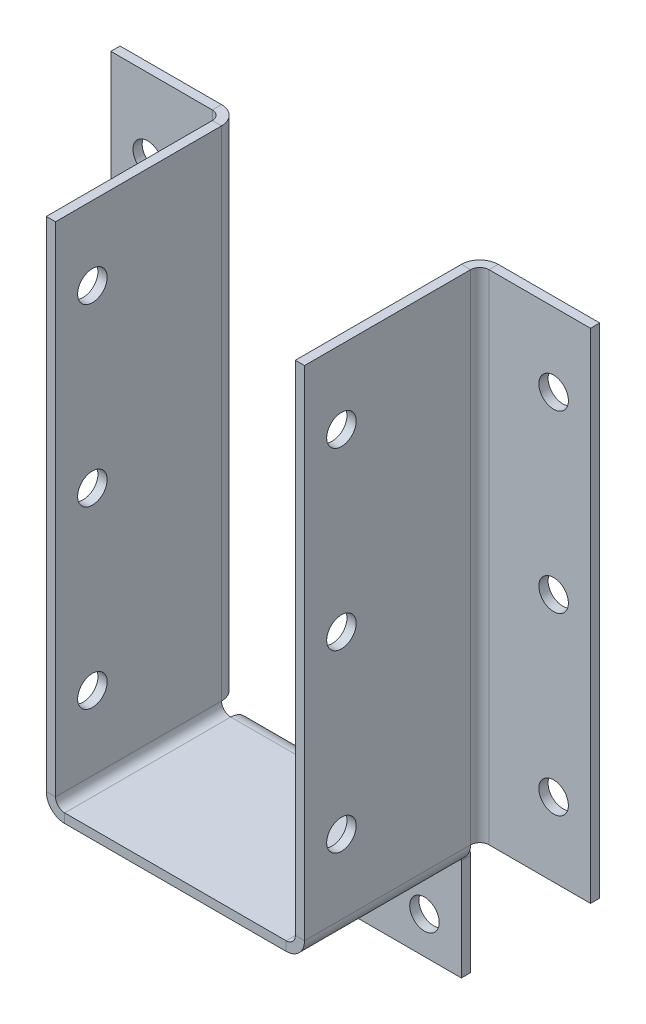
from build123d import *

# Parameters (mm, degrees)
BASE_FLANGE_DEPTH         = 31.75
MITER_FLANGE2_DEPTH       = 88.9
MITER_FLANGE2_2_DEPTH     = 3.175
MITER_START               = 3.175
MITER_FLANGE2_3_DEPTH     = 85.725
MITER_START_2             = -19.05
MITER_FLANGE2_4_OUTLINE_W = 19.05
MITER_FLANGE2_4_OUTLINE_H = 1.5875
MITER_FLANGE2_4_DEPTH     = 17.4625
MITER_FLANGE2_5_DEPTH     = 19.05
MITER_FLANGE2_6_DEPTH     = 19.05
CUT_EXTRUDE1_REACH        = 105.029
SKETCH4_R                 = 2.54
CUT_EXTRUDE2_REACH        = 105.029
SKETCH5_R                 = 2.54
CUT_EXTRUDE4_REACH        = 107.049
SKETCH7_R                 = 2.54


with BuildPart() as part:
    # Base-Flange: sheet metal written as solids
    # Sketch1 → Base-Flange (new body)
    with BuildSketch(Plane.XY):
        with BuildLine():
            Line((0, 0), (19.05, 0))
            ThreePointArc((19.05, 0), (21.29506403, 0.92993597), (22.225, 3.175))
            Line((22.225, 3.175), (22.225, 88.9))
            Line((22.225, 88.9), (20.6375, 88.9))
            Line((20.6375, 88.9), (20.6375, 3.175))
            ThreePointArc((20.6375, 3.175), (20.172532015, 2.052467985), (19.05, 1.5875))
            Line((19.05, 1.5875), (0, 1.5875))
            Line((0, 1.5875), (0, 0))
        make_face()
    extrude(amount=BASE_FLANGE_DEPTH)

    # Miter Flange2: read off the stored shape, not the designer's step
    # Miter Flange2 outline → Miter Flange2 (cut)
    with BuildSketch(Plane(origin=(0, 0, 0), x_dir=(1, 0, 0), z_dir=(0, 1, 0))):
        with BuildLine():
            Line((22.225, 0), (19.05, 0))
            Line((19.05, 0), (19.05, -3.175))
            Line((19.05, -3.175), (20.6375, -3.175))
            ThreePointArc((20.6375, -3.175), (21.062869343, -1.5875), (22.225, -0.425369343))
            Line((22.225, -0.425369343), (22.225, 0))
        make_face()
    extrude(amount=MITER_FLANGE2_DEPTH, mode=Mode.SUBTRACT)

    # Miter Flange2 2 outline → Miter Flange2 2 (cut)
    with BuildSketch(Plane(origin=(0, 0, 0), x_dir=(1, 0, 0), z_dir=(0, 1, 0))):
        with BuildLine():
            Line((20.6375, -3.175), (22.225, -3.175))
            Line((22.225, -3.175), (22.225, -0.425369343))
            ThreePointArc((22.225, -0.425369343), (21.062869343, -1.5875), (20.6375, -3.175))
        make_face()
    extrude(amount=MITER_FLANGE2_2_DEPTH, mode=Mode.SUBTRACT)

    # Miter Flange2 3 outline → Miter Flange2 3 (add)
    with BuildSketch(Plane(origin=(0, 0, 0), x_dir=(1, 0, 0), z_dir=(0, 1, 0)).offset(MITER_START)):
        with BuildLine():
            Line((22.225, -0.425369343), (22.225, -3.175))
            ThreePointArc((22.225, -3.175), (22.689967985, -2.052467985), (23.8125, -1.5875))
            Line((23.8125, -1.5875), (41.275, -1.5875))
            Line((41.275, -1.5875), (41.275, 0))
            Line((41.275, 0), (23.8125, 0))
            ThreePointArc((23.8125, 0), (22.990749532, -0.108185502), (22.225, -0.425369343))
        make_face()
    extrude(amount=MITER_FLANGE2_3_DEPTH)

    # Miter Flange2 5 outline → Miter Flange2 5 (cut)
    with BuildSketch(Plane.YZ):
        with BuildLine():
            ThreePointArc((1.5875, 3.175), (1.162130657, 1.5875), (0, 0.425369343))
            Line((0, 0.425369343), (0, 0))
            Line((0, 0), (1.5875, 0))
            Line((1.5875, 0), (1.5875, 3.175))
        make_face()
    extrude(amount=MITER_FLANGE2_5_DEPTH, mode=Mode.SUBTRACT)



with BuildPart() as body_2:
    # Miter Flange2 4 outline → Miter Flange2 4 (new body)
    with BuildSketch(Plane(origin=(0, 0, 0), x_dir=(1, 0, 0), z_dir=(0, 1, 0)).offset(MITER_START_2)):
        with Locations((9.525, -0.79375)):
            Rectangle(MITER_FLANGE2_4_OUTLINE_W, MITER_FLANGE2_4_OUTLINE_H)
    extrude(amount=MITER_FLANGE2_4_DEPTH)


with BuildPart() as part_1:
    add(part.part)

    add(body_2.part)  # Miter Flange2 6 merges body 2
    # Miter Flange2 6 outline → Miter Flange2 6 (add)
    with BuildSketch(Plane.YZ):
        with BuildLine():
            Line((0, 0.425369343), (0, 3.175))
            ThreePointArc((0, 3.175), (-0.464967985, 2.052467985), (-1.5875, 1.5875))
            Line((-1.5875, 1.5875), (-1.5875, 0))
            ThreePointArc((-1.5875, 0), (-0.765749532, 0.108185502), (0, 0.425369343))
        make_face()
    extrude(amount=MITER_FLANGE2_6_DEPTH)

    # Sketch4 → Cut-Extrude1 (cut, up to next)
    with BuildSketch(Plane(origin=(0, 0, 0), x_dir=(-1, 0, 0), z_dir=(0, 0, -1)), mode=Mode.PRIVATE) as cut_extrude1_sk1:
        with Locations((-34.925, 76.2)):
            Circle(SKETCH4_R)
    cut_extrude1_tool1 = extrude(cut_extrude1_sk1.sketch, amount=-CUT_EXTRUDE1_REACH, mode=Mode.PRIVATE) & part_1.part
    # Sketch4 → Cut-Extrude1 (cut, up to next)
    with BuildSketch(Plane(origin=(0, 0, 0), x_dir=(-1, 0, 0), z_dir=(0, 0, -1)), mode=Mode.PRIVATE) as cut_extrude1_sk2:
        with Locations((-34.925, 46.0375)):
            Circle(SKETCH4_R)
    cut_extrude1_tool2 = extrude(cut_extrude1_sk2.sketch, amount=-CUT_EXTRUDE1_REACH, mode=Mode.PRIVATE) & part_1.part
    # Sketch4 → Cut-Extrude1 (cut, up to next)
    with BuildSketch(Plane(origin=(0, 0, 0), x_dir=(-1, 0, 0), z_dir=(0, 0, -1)), mode=Mode.PRIVATE) as cut_extrude1_sk3:
        with Locations((-34.925, 15.875)):
            Circle(SKETCH4_R)
    cut_extrude1_tool3 = extrude(cut_extrude1_sk3.sketch, amount=-CUT_EXTRUDE1_REACH, mode=Mode.PRIVATE) & part_1.part
    add(cut_extrude1_tool1.solids().sort_by_distance((34.925, 76.2, 0))[0], mode=Mode.SUBTRACT)
    add(cut_extrude1_tool2.solids().sort_by_distance((34.925, 46.0375, 0))[0], mode=Mode.SUBTRACT)
    add(cut_extrude1_tool3.solids().sort_by_distance((34.925, 15.875, 0))[0], mode=Mode.SUBTRACT)

    # Sketch5 → Cut-Extrude2 (cut, up to next)
    with BuildSketch(Plane(origin=(0, 0, 0), x_dir=(-1, 0, 0), z_dir=(0, 0, -1)), mode=Mode.PRIVATE) as cut_extrude2_sk1:
        with Locations((-12.7, -12.7)):
            Circle(SKETCH5_R)
    cut_extrude2_tool1 = extrude(cut_extrude2_sk1.sketch, amount=-CUT_EXTRUDE2_REACH, mode=Mode.PRIVATE) & part_1.part
    add(cut_extrude2_tool1.solids().sort_by_distance((12.7, -12.7, 0))[0], mode=Mode.SUBTRACT)

    # Sketch7 → Cut-Extrude4 (cut, up to next)
    with BuildSketch(Plane(origin=(22.225, -0.213353633, 50.991788494), x_dir=(0, 0, -1), z_dir=(1, 0, 0)), mode=Mode.PRIVATE) as cut_extrude4_sk1:
        with Locations(Location((25.591788494, 76.413353633, 0), (0, 0, 90))):
            Circle(SKETCH7_R)
    cut_extrude4_tool1 = extrude(cut_extrude4_sk1.sketch, amount=-CUT_EXTRUDE4_REACH, mode=Mode.PRIVATE) & part_1.part
    # Sketch7 → Cut-Extrude4 (cut, up to next)
    with BuildSketch(Plane(origin=(22.225, -0.213353633, 50.991788494), x_dir=(0, 0, -1), z_dir=(1, 0, 0)), mode=Mode.PRIVATE) as cut_extrude4_sk2:
        with Locations(Location((25.591788494, 46.250853633, 0), (0, 0, 90))):
            Circle(SKETCH7_R)
    cut_extrude4_tool2 = extrude(cut_extrude4_sk2.sketch, amount=-CUT_EXTRUDE4_REACH, mode=Mode.PRIVATE) & part_1.part
    # Sketch7 → Cut-Extrude4 (cut, up to next)
    with BuildSketch(Plane(origin=(22.225, -0.213353633, 50.991788494), x_dir=(0, 0, -1), z_dir=(1, 0, 0)), mode=Mode.PRIVATE) as cut_extrude4_sk3:
        with Locations(Location((25.591788494, 16.088353633, 0), (0, 0, 90))):
            Circle(SKETCH7_R)
    cut_extrude4_tool3 = extrude(cut_extrude4_sk3.sketch, amount=-CUT_EXTRUDE4_REACH, mode=Mode.PRIVATE) & part_1.part
    add(cut_extrude4_tool1.solids().sort_by_distance((22.225, 76.2, 25.4))[0], mode=Mode.SUBTRACT)
    add(cut_extrude4_tool2.solids().sort_by_distance((22.225, 46.0375, 25.4))[0], mode=Mode.SUBTRACT)
    add(cut_extrude4_tool3.solids().sort_by_distance((22.225, 15.875, 25.4))[0], mode=Mode.SUBTRACT)

    # SHM-Mirror1: part across plane


with BuildPart() as part_2:
    add(part_1.part)
    add(part_1.part.mirror(Plane(origin=(0, 0, 31.75), x_dir=(0, 0, 1), z_dir=(-1, 0, 0))))


solid = part_2.part
